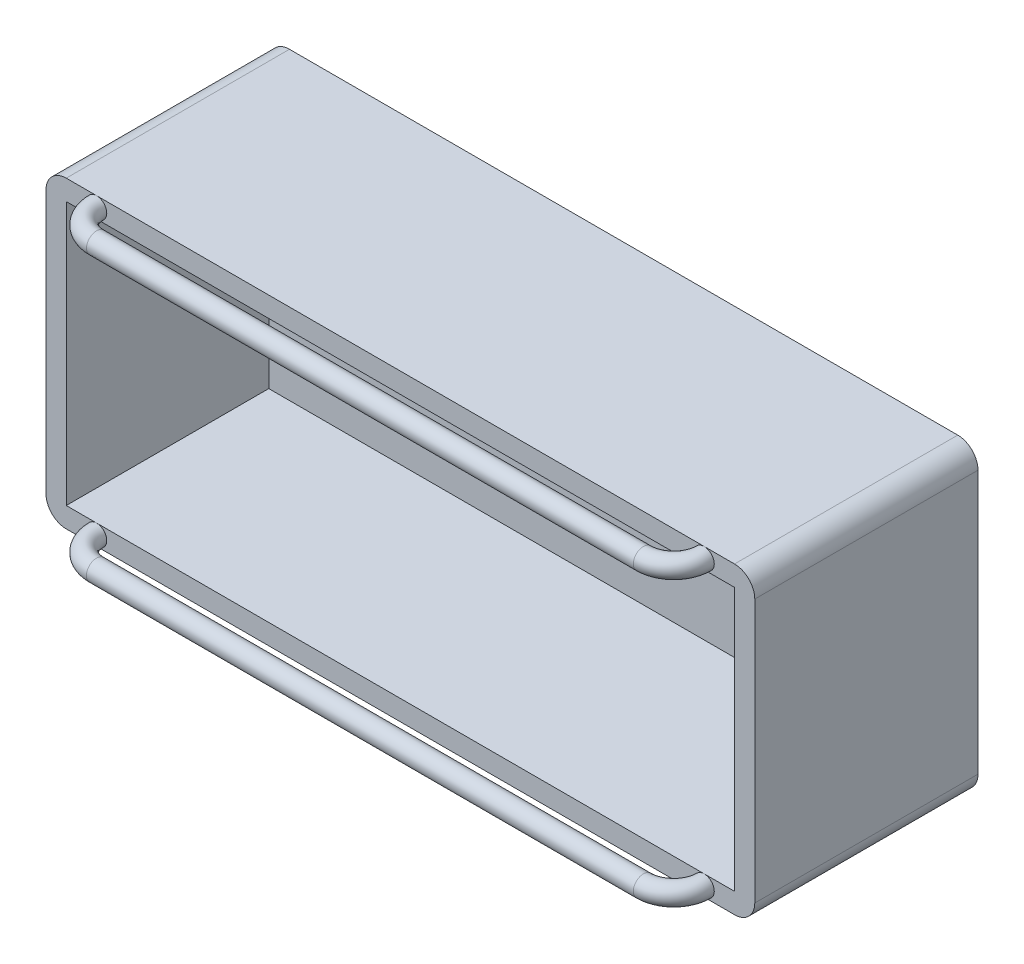
from build123d import *

# Parameters (mm, degrees)
CROQUIS1_W              = 70
CROQUIS1_H              = 30
SALIENTE_EXTRUIR4_DEPTH = 22.045635187
CROQUIS5_W              = 66
CROQUIS5_H              = 26
CORTAR_EXTRUIR1_DEPTH   = 20
CORTAR_EXTRUIR3_DEPTH   = 20
REDONDEO2_R             = 2
REDONDEO3_R             = 2
REDONDEO4_R             = 2
REDONDEO5_R             = 2
BARRER8_OUTLINE_R       = 1
BARRER8_ANGLE           = 90
BARRER8_2_OUTLINE_R     = 1
BARRER8_2_ANGLE         = 90
BARRER8_START           = 21
BARRER8_3_OUTLINE_R     = 1
BARRER8_3_DEPTH         = 1.046635287
BARRER8_START_2         = 7.9899999
BARRER8_4_OUTLINE_R     = 1
BARRER8_4_DEPTH         = 54.0110002
BARRER8_5_OUTLINE_R     = 1
BARRER8_5_DEPTH         = 1.055635287
BARRER9_OUTLINE_R       = 1
BARRER9_ANGLE           = 90
BARRER9_2_OUTLINE_R     = 1
BARRER9_2_ANGLE         = 90
BARRER9_START           = 21
BARRER9_3_OUTLINE_R     = 1
BARRER9_3_DEPTH         = 1.046635287
BARRER9_START_2         = 7.9989999
BARRER9_4_OUTLINE_R     = 1
BARRER9_4_DEPTH         = 54.0020002
BARRER9_5_OUTLINE_R     = 1
BARRER9_5_DEPTH         = 1.046635287


with BuildPart() as part:
    # Croquis1 → Saliente-Extruir4 (new body)
    with BuildSketch(Plane.XY):
        with Locations((35, 15)):
            Rectangle(CROQUIS1_W, CROQUIS1_H)
    extrude(amount=SALIENTE_EXTRUIR4_DEPTH)

    # Croquis5 → Cortar-Extruir1 (cut)
    with BuildSketch(Plane.XY.offset(22.045635187)):
        with Locations((35, 15)):
            Rectangle(CROQUIS5_W, CROQUIS5_H)
    extrude(amount=-CORTAR_EXTRUIR1_DEPTH, mode=Mode.SUBTRACT)

    # Croquis6 → Cortar-Extruir3 (cut)
    with BuildSketch(Plane.XY.offset(2.045635187)):
        with BuildLine():
            Line((10, 17), (24, 17))
            ThreePointArc((24, 17), (26, 15), (24, 13))
            Line((24, 13), (10, 13))
            ThreePointArc((10, 13), (8, 15), (10, 17))
        make_face()
        with BuildLine():
            Line((60, 17), (46, 17))
            ThreePointArc((46, 17), (44, 15), (46, 13))
            Line((46, 13), (60, 13))
            ThreePointArc((60, 13), (62, 15), (60, 17))
        make_face()
    extrude(amount=-CORTAR_EXTRUIR3_DEPTH, mode=Mode.SUBTRACT)

    # Redondeo2
    redondeo2_edges = [part.edges().sort_by_distance(p)[0] for p in [
        (70, 0, 11.022817594),
    ]]
    fillet(redondeo2_edges, radius=REDONDEO2_R)

    # Redondeo3
    redondeo3_edges = [part.edges().sort_by_distance(p)[0] for p in [
        (70, 30, 11.022817594),
    ]]
    fillet(redondeo3_edges, radius=REDONDEO3_R)

    # Redondeo4
    redondeo4_edges = [part.edges().sort_by_distance(p)[0] for p in [
        (0, 0, 11.022817594),
    ]]
    fillet(redondeo4_edges, radius=REDONDEO4_R)

    # Redondeo5
    redondeo5_edges = [part.edges().sort_by_distance(p)[0] for p in [
        (0, 30, 11.022817594),
    ]]
    fillet(redondeo5_edges, radius=REDONDEO5_R)

    # Barrer8 3 outline → Barrer8 3 (add)
    with BuildSketch(Plane.XY.offset(BARRER8_START)):
        with Locations((65, 1)):
            Circle(BARRER8_3_OUTLINE_R)
    extrude(amount=BARRER8_3_DEPTH)



with BuildPart() as body_2:
    # Barrer8: read off the stored shape, not the designer's step
    # Barrer8 outline → Barrer8 (revolve)
    with BuildSketch(Plane(origin=(62.001, 0, 22.046635187), x_dir=(0, 0, 1), z_dir=(-1, 0, 0))):
        with Locations((2.999, 1)):
            Circle(BARRER8_OUTLINE_R)
    revolve(axis=Axis((62.001, 0, 22.046635187), (0, 1, 0)), revolution_arc=BARRER8_ANGLE)



with BuildPart() as body_3:
    # Barrer8 2 outline → Barrer8 2 (revolve)
    with BuildSketch(Plane(origin=(7.99, 0, 22.055635187), x_dir=(-1, 0, 0), z_dir=(0, 0, -1))):
        with Locations((2.99, 1)):
            Circle(BARRER8_2_OUTLINE_R)
    revolve(axis=Axis((7.99, 0, 22.055635187), (0, 1, 0)), revolution_arc=BARRER8_2_ANGLE)


with BuildPart() as body_2_1:
    add(body_2.part)

    add(body_3.part)  # Barrer8 4 merges body 3
    # Barrer8 4 outline → Barrer8 4 (add)
    with BuildSketch(Plane.YZ.offset(BARRER8_START_2)):
        with Locations((1, 25.045635187)):
            Circle(BARRER8_4_OUTLINE_R)
    extrude(amount=BARRER8_4_DEPTH)


with BuildPart() as part_1:
    add(part.part)

    add(body_2_1.part)  # Barrer8 5 merges body 2
    # Barrer8 5 outline → Barrer8 5 (add)
    with BuildSketch(Plane.XY.offset(BARRER8_START)):
        with Locations((5, 1)):
            Circle(BARRER8_5_OUTLINE_R)
    extrude(amount=BARRER8_5_DEPTH)

    # Barrer9 3 outline → Barrer9 3 (add)
    with BuildSketch(Plane.XY.offset(BARRER9_START)):
        with Locations((5, 29)):
            Circle(BARRER9_3_OUTLINE_R)
    extrude(amount=BARRER9_3_DEPTH)



with BuildPart() as body_2_2:
    # Barrer9: read off the stored shape, not the designer's step
    # Barrer9 outline → Barrer9 (revolve)
    with BuildSketch(Plane(origin=(7.999, 0, 22.046635187), x_dir=(-1, 0, 0), z_dir=(0, 0, -1))):
        with Locations((2.999, 29)):
            Circle(BARRER9_OUTLINE_R)
    revolve(axis=Axis((7.999, 0, 22.046635187), (0, 1, 0)), revolution_arc=BARRER9_ANGLE)



with BuildPart() as body_3_2:
    # Barrer9 2 outline → Barrer9 2 (revolve)
    with BuildSketch(Plane(origin=(62.001, 0, 22.046635187), x_dir=(0, 0, 1), z_dir=(-1, 0, 0))):
        with Locations((2.999, 29)):
            Circle(BARRER9_2_OUTLINE_R)
    revolve(axis=Axis((62.001, 0, 22.046635187), (0, 1, 0)), revolution_arc=BARRER9_2_ANGLE)


with BuildPart() as body_2_2_1:
    add(body_2_2.part)

    add(body_3_2.part)  # Barrer9 4 merges body 3 2
    # Barrer9 4 outline → Barrer9 4 (add)
    with BuildSketch(Plane.YZ.offset(BARRER9_START_2)):
        with Locations((29, 25.045635187)):
            Circle(BARRER9_4_OUTLINE_R)
    extrude(amount=BARRER9_4_DEPTH)


with BuildPart() as part_2:
    add(part_1.part)

    add(body_2_2_1.part)  # Barrer9 5 merges body 2 2
    # Barrer9 5 outline → Barrer9 5 (add)
    with BuildSketch(Plane.XY.offset(BARRER9_START)):
        with Locations((65, 29)):
            Circle(BARRER9_5_OUTLINE_R)
    extrude(amount=BARRER9_5_DEPTH)


solid = part_2.part
